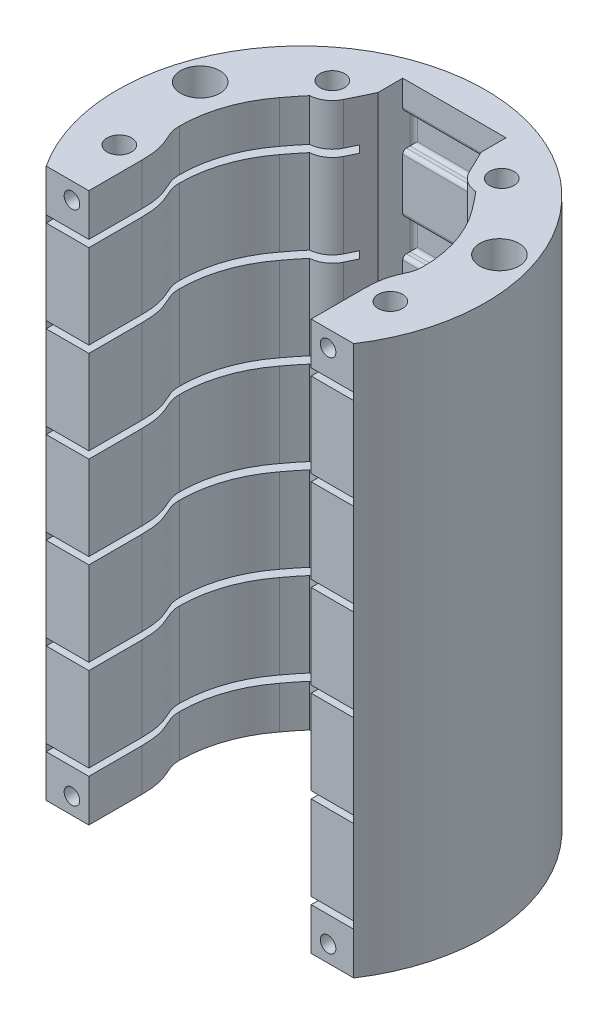
from build123d import *

# Parameters (mm, degrees)
SKETCH1_R               = 3.35
SKETCH1_R_2             = 5.3721
BOSS_EXTRUDE2_DEPTH     = 150
SLOT_DEPTH              = 0.975
SKETCH2_W               = 28.2
SKETCH2_H               = 9.048762348
CUT_EXTRUDE1_DEPTH      = 3
FILLET1_R               = 1
LPATTERN1_COUNT         = 6
LPATTERN1_PITCH         = 25
FILLET1_OF_LPATTERN1_R  = 1
SKETCH7_R               = 2.125
CUT_EXTRUDE2_DEPTH      = 8
MIRROR2_COPY_1_SKETCH_R = 2.125
MIRROR2_COPY_1_DEPTH    = 8


with BuildPart() as part:
    # Sketch1 → Boss-Extrude2 (new body)
    with BuildSketch(Plane(origin=(0, 0, 0), x_dir=(1, 0, 0), z_dir=(0, 1, 0))):
        with BuildLine():
            Line((-41.978758021, -27.696013052), (-30.348758021, -27.696013052))
            Line((-30.348758021, -27.696013052), (-30.348758021, -13.232808954))
            add(Edge.make_bspline(
                [(-30.348758021, -13.232808954), (-30.348758021, -4.818714921), (-33.264468406, -4.744134389), (-33.264468406, 0)],
                knots=[0, 0, 0, 0, 1, 1, 1, 1], degree=3))
            ThreePointArc((-33.264468406, 0), (-31.488556898, 10.723602139), (-26.350445826, 20.302188629))
            add(Edge.make_bspline(
                [(-26.350445826, 20.302188629), (-24.374677003, 22.988127573), (-22.681011433, 24.921676571)],
                knots=[0, 0, 0, 1, 1, 1], degree=2))
            ThreePointArc((-22.681011433, 24.921676571), (-19.402847958, 26.048993856), (-17.137442499, 28.672948531))
            Line((-17.137442499, 28.672948531), (-14.1, 34.984991814))
            Line((-14.1, 34.984991814), (-14.1, 41.76))
            Line((-14.1, 41.76), (14.1, 41.76))
            Line((14.1, 41.76), (14.1, 34.984991814))
            Line((14.1, 34.984991814), (17.137442499, 28.672948531))
            ThreePointArc((17.137442499, 28.672948531), (19.402847958, 26.048993856), (22.681011433, 24.921676571))
            add(Edge.make_bspline(
                [(26.350445826, 20.302188629), (24.374677003, 22.988127573), (22.681011433, 24.921676571)],
                knots=[0, 0, 0, 1, 1, 1], degree=2))
            ThreePointArc((26.350445826, 20.302188629), (31.488556898, 10.723602139), (33.264468406, 0))
            add(Edge.make_bspline(
                [(30.348758021, -13.232808954), (30.348758021, -4.818714921), (33.264468406, -4.744134389), (33.264468406, 0)],
                knots=[0, 0, 0, 0, 1, 1, 1, 1], degree=3))
            Line((30.348758021, -13.232808954), (30.348758021, -27.696013052))
            Line((30.348758021, -27.696013052), (41.978758021, -27.696013052))
            ThreePointArc((41.978758021, -27.696013052), (0, 50.292), (-41.978758021, -27.696013052))
        make_face()
        with Locations((-37.000474826, -12.718618748)):
            Circle(SKETCH1_R, mode=Mode.SUBTRACT)
        with Locations((37.000474826, -12.718618748)):
            Circle(SKETCH1_R, mode=Mode.SUBTRACT)
        with Locations((-40.847062798, 13.209934169)):
            Circle(SKETCH1_R_2, mode=Mode.SUBTRACT)
        with Locations((-23.129730363, 31.556520301)):
            Circle(SKETCH1_R, mode=Mode.SUBTRACT)
        with Locations((40.847062798, 13.209934169)):
            Circle(SKETCH1_R_2, mode=Mode.SUBTRACT)
        with Locations((23.129730363, 31.556520301)):
            Circle(SKETCH1_R, mode=Mode.SUBTRACT)
    extrude(amount=BOSS_EXTRUDE2_DEPTH)

    # Sketch6 → slot (cut, symmetric)
    with BuildSketch(Plane(origin=(0, 12.5, 0), x_dir=(-1, 0, 0), z_dir=(0, -1, 0))):
        with BuildLine():
            Line((-41.978758021, -27.696013052), (41.978758021, -27.696013052))
            Line((41.978758021, -27.696013052), (42.348813141, -12.851950168))
            ThreePointArc((42.348813141, -12.851950168), (42.298623582, -11.975571138), (42.105800179, -11.119196027))
            Line((42.105800179, -11.119196027), (28.235055716, 33.155943022))
            ThreePointArc((28.235055716, 33.155943022), (24.341289072, 36.767530328), (19.253636812, 35.244120983))
            Line((19.253636812, 35.244120983), (13.047964359, 28.721243631))
            ThreePointArc((13.047964359, 28.721243631), (12.816725989, 28.560405037), (12.540811932, 28.50373344))
            Line((12.540811932, 28.50373344), (10.657647051, 28.50373344))
            ThreePointArc((10.657647051, 28.50373344), (10.516225695, 28.562312083), (10.457647051, 28.70373344))
            Line((10.457647051, 28.70373344), (10.457647051, 36.268969967))
            Line((10.457647051, 36.268969967), (9.766617018, 36.96))
            Line((9.766617018, 36.96), (-0.68191112, 36.96))
            Line((-0.68191112, 36.96), (-1.357647051, 36.284264069))
            Line((-1.357647051, 36.284264069), (-1.357647051, 29.218375638))
            ThreePointArc((-1.357647051, 29.218375638), (-2.007647051, 28.607259567), (-2.657647051, 29.218375638))
            Line((-2.657647051, 29.218375638), (-2.657647051, 36.284264069))
            Line((-2.657647051, 36.284264069), (-3.333382982, 36.96))
            Line((-3.333382982, 36.96), (-9.78191112, 36.96))
            Line((-9.78191112, 36.96), (-10.457647051, 36.284264069))
            Line((-10.457647051, 36.284264069), (-10.457647051, 28.70373344))
            ThreePointArc((-10.457647051, 28.70373344), (-10.516225695, 28.562312083), (-10.657647051, 28.50373344))
            Line((-10.657647051, 28.50373344), (-12.540811932, 28.50373344))
            ThreePointArc((-12.540811932, 28.50373344), (-12.816725989, 28.560405037), (-13.047964359, 28.721243631))
            Line((-13.047964359, 28.721243631), (-19.253636812, 35.244120983))
            ThreePointArc((-19.253636812, 35.244120983), (-24.341289072, 36.767530328), (-28.235055716, 33.155943022))
            Line((-28.235055716, 33.155943022), (-42.105800179, -11.119196027))
            ThreePointArc((-42.105800179, -11.119196027), (-42.298623582, -11.975571138), (-42.348813141, -12.851950168))
            Line((-42.348813141, -12.851950168), (-41.978758021, -27.696013052))
        make_face()
    slot = extrude(amount=SLOT_DEPTH, both=True, mode=Mode.SUBTRACT)

    # Sketch2 → Cut-Extrude1 (cut)
    with BuildSketch(Plane.XY.offset(-41.76)):
        with Locations((0, 12.5)):
            Rectangle(SKETCH2_W, SKETCH2_H)
    cut_extrude1 = extrude(amount=-CUT_EXTRUDE1_DEPTH, mode=Mode.SUBTRACT)

    # Fillet1
    fillet1_edges = [part.edges().sort_by_distance(p)[0] for p in [
        (0, 17.024381174, -44.76),
        (14.1, 12.5, -44.76),
        (0, 7.975618826, -44.76),
        (-14.1, 12.5, -44.76),
        (0, 7.975618826, -41.76),
        (0, 17.024381174, -41.76),
    ]]
    fillet(fillet1_edges, radius=FILLET1_R)

    # LPattern1: slot, Cut-Extrude1 ×6
    with Locations(*[(0, i * LPATTERN1_PITCH, 0) for i in range(1, LPATTERN1_COUNT)]):
        add(slot, mode=Mode.SUBTRACT)
        add(cut_extrude1, mode=Mode.SUBTRACT)

    # Fillet1 of LPattern1
    fillet1_of_lpattern1_edges = [part.edges().sort_by_distance(p)[0] for p in [
        (0, 42.024381174, -44.76),
        (14.1, 37.5, -44.76),
        (0, 32.975618826, -44.76),
        (-14.1, 37.5, -44.76),
        (0, 32.975618826, -41.76),
        (0, 42.024381174, -41.76),
        (0, 67.024381174, -44.76),
        (14.1, 62.5, -44.76),
        (0, 57.975618826, -44.76),
        (-14.1, 62.5, -44.76),
        (0, 57.975618826, -41.76),
        (0, 67.024381174, -41.76),
        (0, 92.024381174, -44.76),
        (14.1, 87.5, -44.76),
        (0, 82.975618826, -44.76),
        (-14.1, 87.5, -44.76),
        (0, 82.975618826, -41.76),
        (0, 92.024381174, -41.76),
        (0, 117.024381174, -44.76),
        (14.1, 112.5, -44.76),
        (0, 107.975618826, -44.76),
        (-14.1, 112.5, -44.76),
        (0, 107.975618826, -41.76),
        (0, 117.024381174, -41.76),
        (0, 142.024381174, -44.76),
        (14.1, 137.5, -44.76),
        (0, 132.975618826, -44.76),
        (-14.1, 137.5, -44.76),
        (0, 132.975618826, -41.76),
        (0, 142.024381174, -41.76),
    ]]
    fillet(fillet1_of_lpattern1_edges, radius=FILLET1_OF_LPATTERN1_R)

    # Sketch7 → Cut-Extrude2 (cut)
    with BuildSketch(Plane.XY.offset(27.696013052)):
        with Locations((34.962080117, 4.5125)):
            Circle(SKETCH7_R)
    cut_extrude2 = extrude(amount=-CUT_EXTRUDE2_DEPTH, mode=Mode.SUBTRACT)

    # Mirror1: Cut-Extrude2 across plane
    add(cut_extrude2.mirror(Plane(origin=(0, 0, 0), x_dir=(0, 0, 1), z_dir=(1, 0, 0))), mode=Mode.SUBTRACT)

    # Mirror2: Cut-Extrude2 across plane
    add(cut_extrude2.mirror(Plane(origin=(0, 75, 0), x_dir=(0, 0, 1), z_dir=(0, -1, 0))), mode=Mode.SUBTRACT)

    # Mirror2 copy 1 sketch → Mirror2 copy 1 (cut)
    with BuildSketch(Plane(origin=(0, 150, 27.696013052), x_dir=(-1, 0, 0), z_dir=(0, 0, 1))):
        with Locations((34.962080117, 4.5125)):
            Circle(MIRROR2_COPY_1_SKETCH_R)
    extrude(amount=-MIRROR2_COPY_1_DEPTH, mode=Mode.SUBTRACT)


solid = part.part
